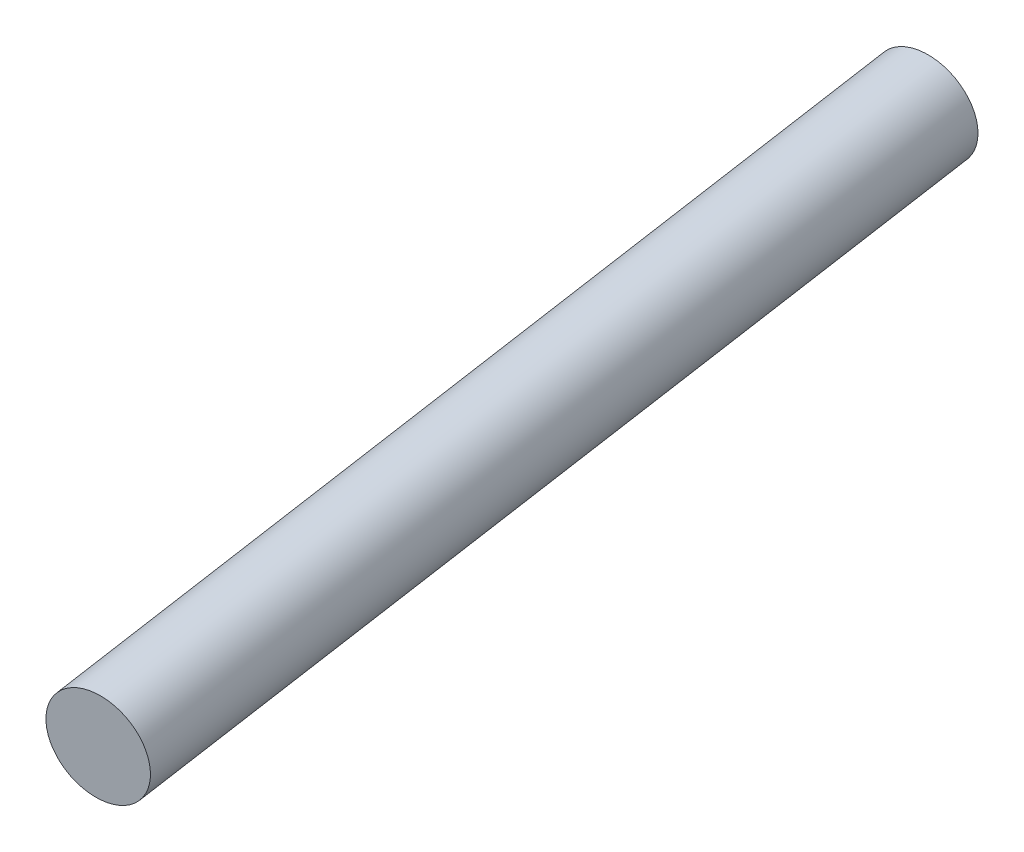
from build123d import *

# Parameters (mm, degrees)
BOSS_EXTRUDE1_START     = -121.427573334
BOSS_EXTRUDE1_OUTLINE_R = 6.35
BOSS_EXTRUDE1_DEPTH     = 121.427573334


# Read off the part's stored shape, not the designer's step: Boss-Extrude1
with BuildPart() as part:
    # Boss-Extrude1 outline → Boss-Extrude1 (new body)
    with BuildSketch(Plane(origin=(-5.053502813, 3.433068434, -54.728063299), x_dir=(-0.9957762428877978, -0.002869385405095792, 0.09176840811335334), z_dir=(-0.09176840811335332, 0.06234234684769221, -0.9938269422096904)).offset(BOSS_EXTRUDE1_START)):
        with Locations((79.883057054, -8.899018068)):
            Circle(BOSS_EXTRUDE1_OUTLINE_R)
    extrude(amount=BOSS_EXTRUDE1_DEPTH)


solid = part.part
